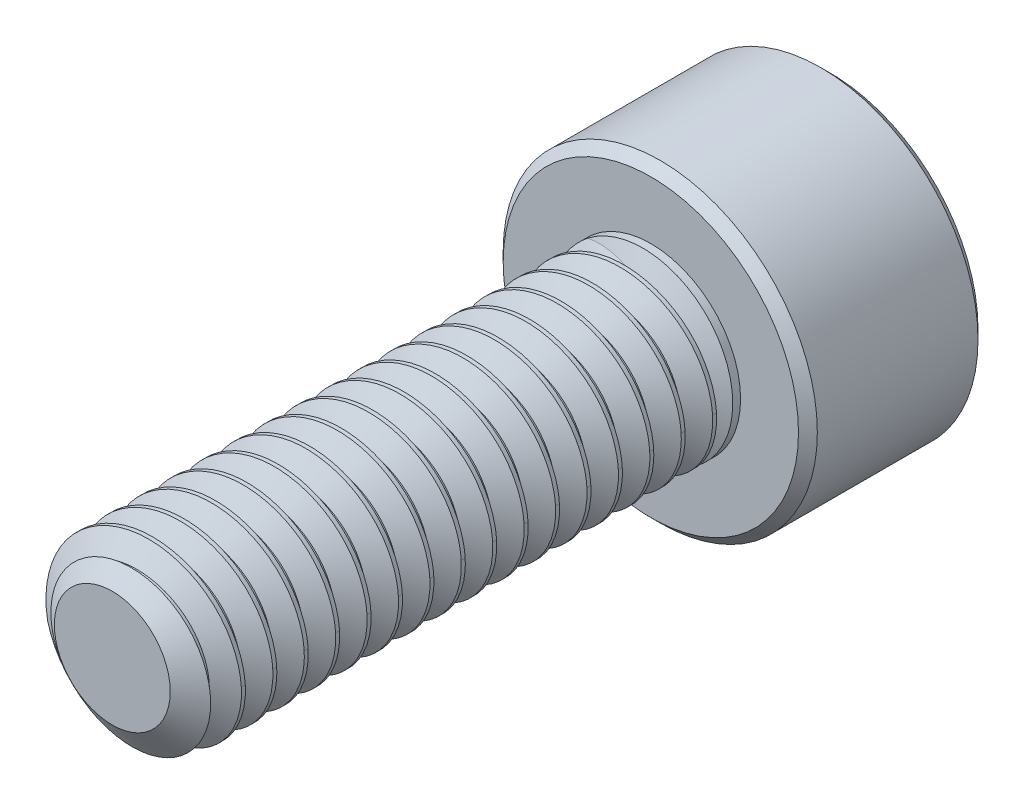
from build123d import *
from build123d.topology import SkipClean

# Parameters (mm, degrees)
SKETCH1_R          = 2
EXTRUDE1_DEPTH     = 12
CUT_SWEEP1_PITCH   = 0.7
SKETCH6_R          = 3.5
EXTRUDE2_DEPTH     = 4
CUT_EXTRUDE1_DEPTH = 2.25
CHAMFER1_SIZE      = 0.21


with BuildPart() as part:
    # Sketch1 → Extrude1 (new body)
    with BuildSketch(Plane.XY):
        Circle(SKETCH1_R)
    extrude(amount=-EXTRUDE1_DEPTH)

    # Cut-Sweep1: the profile of Sketch3 profile screwed along a right-hand helix of 18.142857 turns, 6 arcs to a turn; built about Z, then put on its axis
    cut_sweep1_z = Axis((0, 0, 0), (0, 0, 1))
    cut_sweep1_corners = [(2.0003, 0, -0.612673205), (1.545336663, 0, -0.35), (1.545336663, 0, -0.2625), (2.0003, 0, 0.000173205)]
    with BuildLine(mode=Mode.PRIVATE) as cut_sweep1_profile:
        Line(cut_sweep1_corners[0], cut_sweep1_corners[1])
        Line(cut_sweep1_corners[1], cut_sweep1_corners[2])
        Line(cut_sweep1_corners[2], cut_sweep1_corners[3])
        Line(cut_sweep1_corners[3], cut_sweep1_corners[0])
    cut_sweep1_cap = Face(cut_sweep1_profile.wire())
    cut_sweep1_turn_angles = [0, 30, 60, 90, 120, 150, 180, 210, 240, 270, 300, 330, 360]
    cut_sweep1_turn_weights = [1, 0.8660254037844387, 1, 0.8660254037844387, 1, 0.8660254037844387, 1, 0.8660254037844387, 1, 0.8660254037844387, 1, 0.8660254037844387, 1]
    cut_sweep1_turn_rails = [Edge.make_bspline([Vector(p[0], p[1], 0).rotate(cut_sweep1_z, cut_sweep1_turn_angles[k]) / cut_sweep1_turn_weights[k] + Vector(0, 0, p[2] + CUT_SWEEP1_PITCH * cut_sweep1_turn_angles[k] / 360) for k in range(13)], [0, 0, 0, 1, 1, 2, 2, 3, 3, 4, 4, 5, 5, 6, 6, 6], 2, cut_sweep1_turn_weights) for p in cut_sweep1_corners]
    cut_sweep1_turn_sides = [Face.make_surface_from_curves(cut_sweep1_turn_rails[p[0]], cut_sweep1_turn_rails[p[1]]) for p in [(0, 1), (1, 2), (2, 3), (3, 0)]]
    cut_sweep1_last_angles = [6480, 6505.714285714, 6531.428571429]
    cut_sweep1_last_weights = [1, 0.9009688679026391, 1]
    cut_sweep1_last_rails = [Edge.make_bspline([Vector(p[0], p[1], 0).rotate(cut_sweep1_z, cut_sweep1_last_angles[k]) / cut_sweep1_last_weights[k] + Vector(0, 0, p[2] + CUT_SWEEP1_PITCH * cut_sweep1_last_angles[k] / 360) for k in range(3)], [0, 0, 0, 1, 1, 1], 2, cut_sweep1_last_weights) for p in cut_sweep1_corners]
    cut_sweep1_last_sides = [Face.make_surface_from_curves(cut_sweep1_last_rails[p[0]], cut_sweep1_last_rails[p[1]]) for p in [(0, 1), (1, 2), (2, 3), (3, 0)]]
    cut_sweep1 = Plane(origin=(0, 0, 0), x_dir=(0, 1, 0), z_dir=(0, 0, -1)) * Solid(Shell([*[p.moved(Location((0, 0, CUT_SWEEP1_PITCH * i))) for i in range(18) for p in cut_sweep1_turn_sides], *cut_sweep1_last_sides, cut_sweep1_cap, cut_sweep1_cap.rotate(cut_sweep1_z, 6531.428571429).moved(Location((0, 0, CUT_SWEEP1_PITCH * 6531.428571429 / 360)))]))
    add(cut_sweep1, mode=Mode.SUBTRACT)

    # Sketch4 → Cut-Revolve1 (revolve, cut)
    with BuildSketch(Plane(origin=(0, 0, 0), x_dir=(0, 0, -1), z_dir=(1, 0, 0)), mode=Mode.PRIVATE) as cut_revolve1_sk:
        Polygon((0.496211411, 2), (0, 1.291336663), (0, 2), align=None)
    revolve(cut_revolve1_sk.sketch.rotate(Axis((0, 0, 0), (0, 0, -1)), 271.401126896), axis=Axis((0, 0, 0), (0, 0, -1)), mode=Mode.SUBTRACT)

    # Sketch6 → Extrude2 (add)
    with BuildSketch(Plane(origin=(0, 0, -12), x_dir=(-1, 0, 0), z_dir=(0, 0, -1))):
        Circle(SKETCH6_R)
    extrude(amount=EXTRUDE2_DEPTH)

    # Sketch7 → Cut-Extrude1 (cut)
    with BuildSketch(Plane(origin=(0, 0, -16), x_dir=(-1, 0, 0), z_dir=(0, 0, -1))):
        Polygon((0, 1.732050808), (-1.5, 0.866025404), (-1.5, -0.866025404), (0, -1.732050808), (1.5, -0.866025404), (1.5, 0.866025404), align=None)
    extrude(amount=-CUT_EXTRUDE1_DEPTH, mode=Mode.SUBTRACT)

    # Cut-Extrude2 cone 1 section (through the dimple's axis) → Cut-Extrude2 (revolve, cut)
    with BuildSketch(Plane(origin=(0, 0, -16), x_dir=(0, 1, 0), z_dir=(1, 0, 0))):
        Polygon((0, 0), (1.732050808, 0), (0, 1.732050808), align=None)
    revolve(axis=Axis((0, 0, -16), (0, 0, 1)), mode=Mode.SUBTRACT)

    # Chamfer1
    chamfer1_edges = [part.edges().sort_by_distance(p)[0] for p in [
        (3.5, 0, -12),
        (3.5, 0, -16),
    ]]
    chamfer(chamfer1_edges, length=CHAMFER1_SIZE)

    # Sketch10 → Revolve1 (revolve)
    with SkipClean():  # the faces are left unmerged after this step: merging them gives an invalid solid
        with BuildSketch(Plane(origin=(0, 0, 0), x_dir=(0, 0, -1), z_dir=(1, 0, 0)), mode=Mode.PRIVATE) as revolve1_sk:
            Polygon((12, 2), (12, 0), (10.996572875, 0), (11.825, 2), align=None)
        revolve(revolve1_sk.sketch.rotate(Axis((0, 0, -12), (0, 0, 1)), 270), axis=Axis((0, 0, -12), (0, 0, 1)))


solid = part.part
